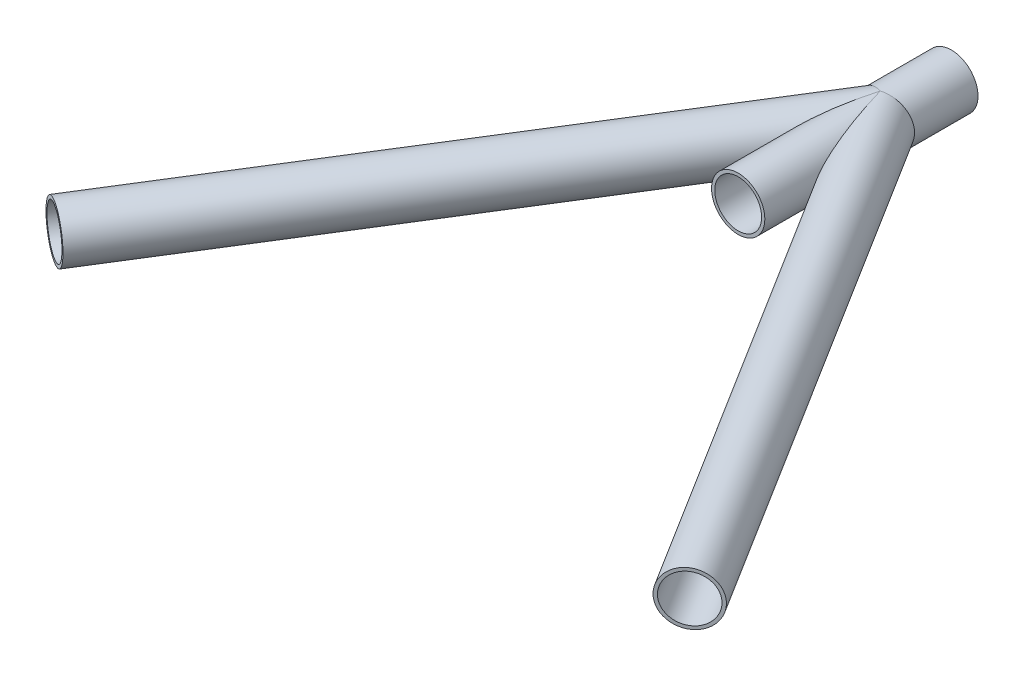
from build123d import *

# Parameters (mm, degrees)
SKETCH1_R               = 9.525
SKETCH1_R_2             = 8.382
BOSS_EXTRUDE2_DEPTH     = 76.2
SWEEP_THIN6_OUTLINE_W   = 1.143
SWEEP_THIN6_OUTLINE_H   = 214.223120754
SWEEP_THIN8_PROFILE_R   = 9.525
SWEEP_THIN8_PROFILE_R_2 = 8.382


# Read off the part's stored shape, not the designer's step: Sweep-Thin6
with BuildPart() as part:
    # Sketch1 → Boss-Extrude2 (new body)
    with BuildSketch(Plane.XY):
        with Locations(Location((0, 0, 0), (0, 0, 180))):
            Circle(SKETCH1_R)
        with Locations(Location((0, 0, 0), (0, 0, 180))):
            Circle(SKETCH1_R_2, mode=Mode.SUBTRACT)
    extrude(amount=BOSS_EXTRUDE2_DEPTH)

    # Sweep-Thin6 outline → Sweep-Thin6 (revolve)
    with BuildSketch(Plane(origin=(-11.415730337, 0, 7.134831461), x_dir=(0.8479983040050879, 0, -0.52999894000318), z_dir=(0, -1, 0))):
        with Locations((8.9535, 128.650717299)):
            Rectangle(SWEEP_THIN6_OUTLINE_W, SWEEP_THIN6_OUTLINE_H)
    revolve(axis=Axis((-11.415730337, 0, 7.134831461), (0.52999894000318, 0, 0.8479983040050879)))

    # Sweep-Thin8: sweep along a curve in space
    with BuildLine() as sweep_thin8_path:
        Line((0, 0, 0), (0, 0, 25.4))
        Line((0, 0, 25.4), (-113.538026924, 0, 207.060843078))
    # Sweep-Thin8 profile (on start of the path) → Sweep-Thin8 (sweep)
    with BuildSketch(Plane.XY):
        Circle(SWEEP_THIN8_PROFILE_R)
        Circle(SWEEP_THIN8_PROFILE_R_2, mode=Mode.SUBTRACT)
    sweep(path=sweep_thin8_path.line, transition=Transition.RIGHT)


solid = part.part
